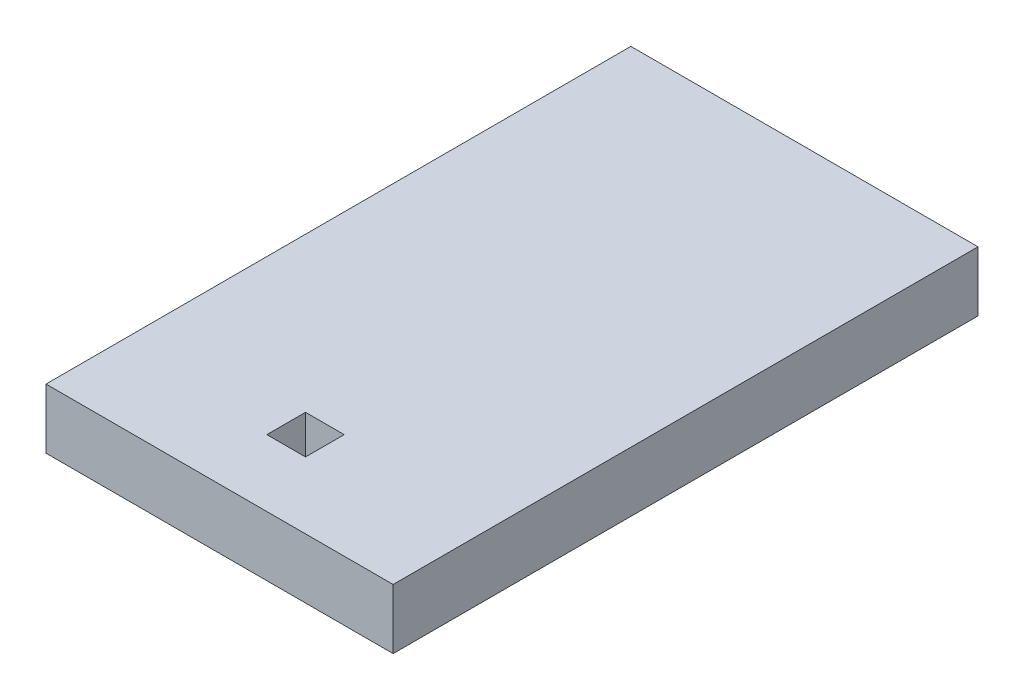
from build123d import *

# Parameters (mm, degrees)
SKETCH1_W           = 21.575
SKETCH1_H           = 31
SKETCH1_W_2         = 2.05
SKETCH1_H_2         = 2.05
BOSS_EXTRUDE1_DEPTH = 3.175
SKETCH2_W           = 3.175
SKETCH2_H           = 31
CUT_EXTRUDE1_DEPTH  = 21.086593788


with BuildPart() as part:
    # Sketch1 → Boss-Extrude1 (new body)
    with BuildSketch(Plane(origin=(0, 0, 0), x_dir=(1, 0, 0), z_dir=(0, 1, 0))):
        with Locations((-1.5875, 0)):
            Rectangle(SKETCH1_W, SKETCH1_H)
        with Locations((0, -10.94424342)):
            Rectangle(SKETCH1_W_2, SKETCH1_H_2, mode=Mode.SUBTRACT)
    extrude(amount=BOSS_EXTRUDE1_DEPTH)

    # Sketch2 → Cut-Extrude1 (cut, through all)
    with BuildSketch(Plane(origin=(0, 3.175, 0), x_dir=(1, 0, 0), z_dir=(0, 1, 0))):
        with Locations((-10.7875, 0)):
            Rectangle(SKETCH2_W, SKETCH2_H)
    extrude(amount=-CUT_EXTRUDE1_DEPTH, mode=Mode.SUBTRACT)


solid = part.part
